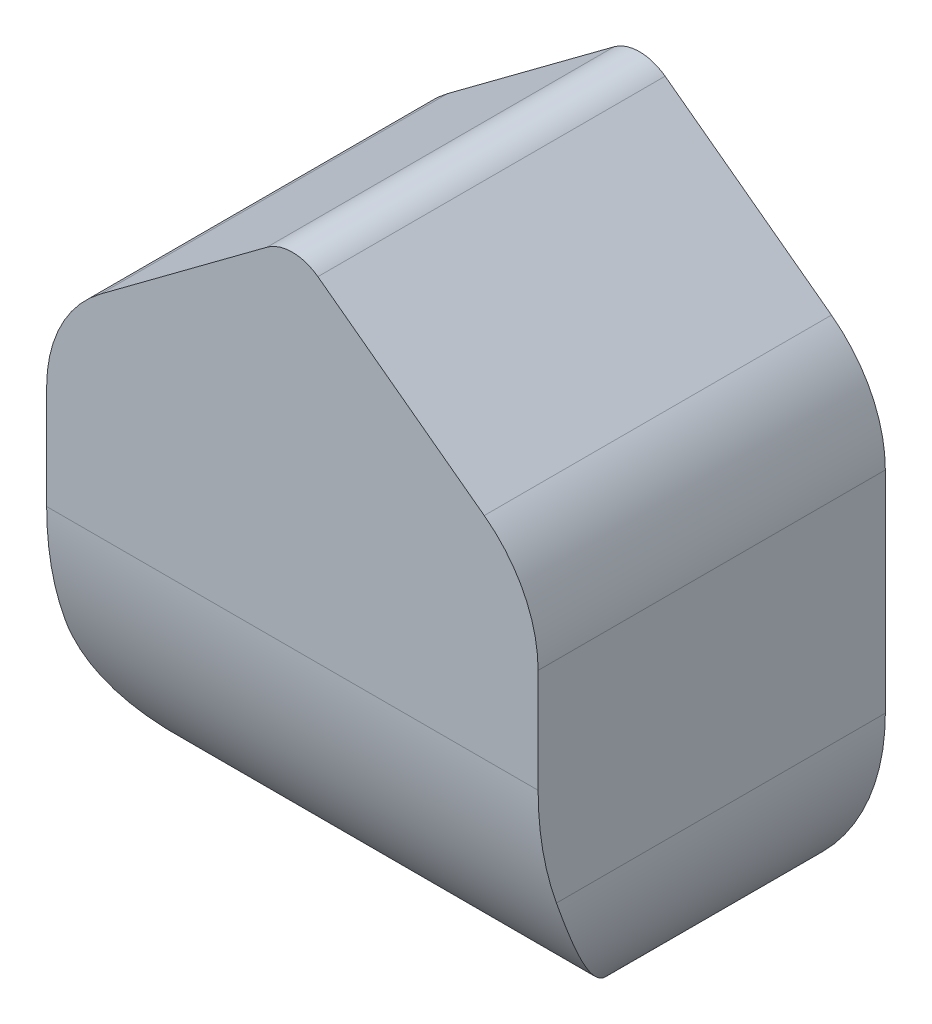
from build123d import *

# Parameters (mm, degrees)
BOSS_EXTRUDE1_DEPTH = 13
FILLET1_R           = 12
CUT_EXTRUDE1_DEPTH  = 8
SKETCH5_R           = 4.716803238
CUT_EXTRUDE2_DEPTH  = 8
SKETCH6_W           = 4.554767644
SKETCH6_H           = 3.613594083
CUT_EXTRUDE3_DEPTH  = 8


with BuildPart() as part:
    # Sketch2 → Boss-Extrude1 (new body)
    with BuildSketch(Plane.XY):
        with BuildLine():
            Line((8, 0), (10.4, 0))
            ThreePointArc((10.4, 0), (16.056854249, 2.343145751), (18.4, 8))
            Line((18.4, 8), (18.4, 15.886901909))
            ThreePointArc((18.4, 15.886901909), (17.867444955, 18.132327386), (16.383225769, 19.899427797))
            Line((16.383225769, 19.899427797), (10.154632246, 24.530251678))
            ThreePointArc((10.154632246, 24.530251678), (9.2, 24.846243393), (8.245367754, 24.530251678))
            Line((8.245367754, 24.530251678), (2.016774231, 19.899427797))
            ThreePointArc((2.016774231, 19.899427797), (0.532555045, 18.132327386), (0, 15.886901909))
            Line((0, 15.886901909), (0, 8))
            ThreePointArc((0, 8), (2.343145751, 2.343145751), (8, 0))
        make_face()
    extrude(amount=BOSS_EXTRUDE1_DEPTH)

    # Fillet1
    # the kernel refuses this fillet: 12 mm, written as the material it takes off along each edge
    with BuildSketch(Plane(origin=(-22, 0, 13), x_dir=(0, 0, -1), z_dir=(1, 0, 0))) as fillet1_piece_1:
        with BuildLine():
            CenterArc((FILLET1_R, FILLET1_R), FILLET1_R, 180, 90)
            Line((0, FILLET1_R), (0, 0))
            Line((0, 0), (FILLET1_R, 0))
        make_face()
    extrude(amount=62.4, mode=Mode.SUBTRACT)

    # Sketch4 → Cut-Extrude1 (cut)
    with BuildSketch(Plane(origin=(0, 0, 0), x_dir=(-1, 0, 0), z_dir=(0, 0, -1))):
        Polygon((-9.2, 23.296502957), (-16.939792645, 18.15947244), (-16.939792645, 15.04300726), (-1.460207355, 15.04300726), (-1.460207355, 18.15947244), align=None)
        Polygon((-1.460207355, 9.289533082), (-16.939792645, 9.289533082), (-16.939792645, 5.214155538), (-9.2, 0.899049904), (-1.460207355, 5.214155538), align=None)
    extrude(amount=-CUT_EXTRUDE1_DEPTH, mode=Mode.SUBTRACT)

    # Sketch5 → Cut-Extrude2 (cut)
    with BuildSketch(Plane(origin=(0, 0, 0), x_dir=(-1, 0, 0), z_dir=(0, 0, -1))):
        with Locations((-9.2, 7.64)):
            Circle(SKETCH5_R)
    extrude(amount=-CUT_EXTRUDE2_DEPTH, mode=Mode.SUBTRACT)

    # Sketch6 → Cut-Extrude3 (cut)
    with BuildSketch(Plane(origin=(0, 0, 0), x_dir=(-1, 0, 0), z_dir=(0, 0, -1))):
        with Locations((-9.2, 13.577384858)):
            Rectangle(SKETCH6_W, SKETCH6_H)
    extrude(amount=-CUT_EXTRUDE3_DEPTH, mode=Mode.SUBTRACT)


solid = part.part
